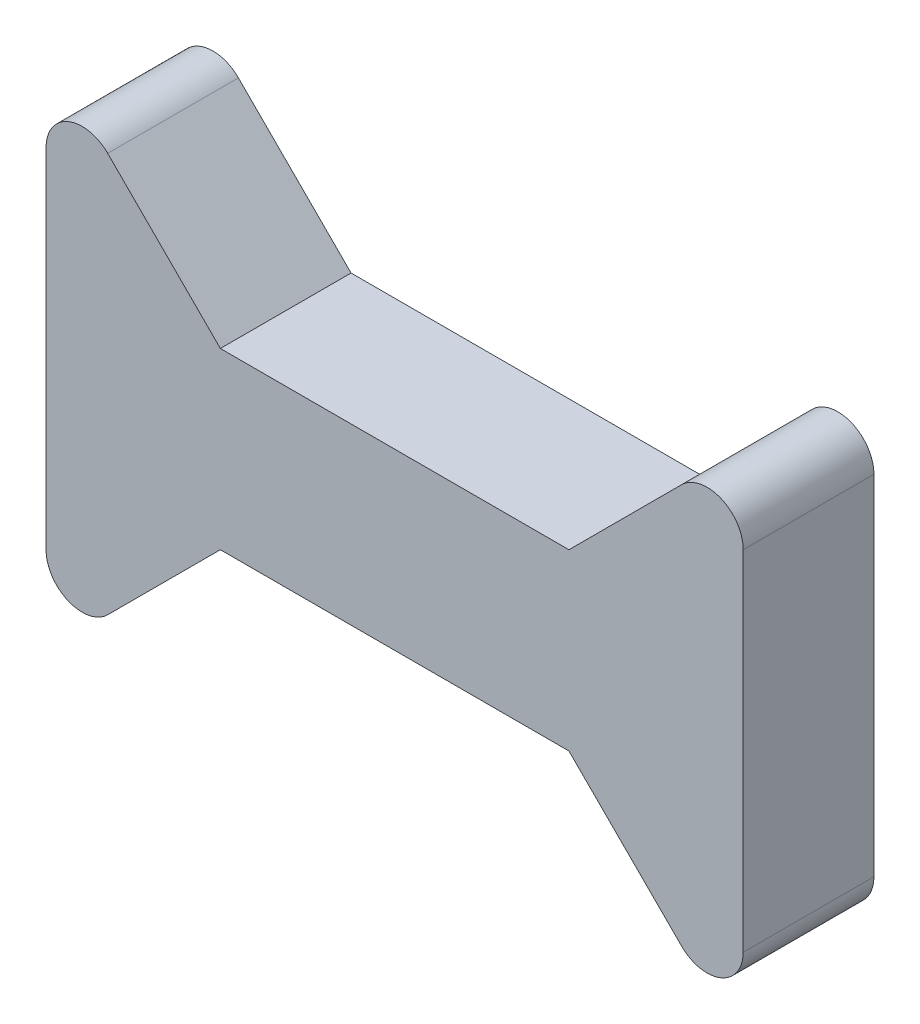
from build123d import *

# Parameters (mm, degrees)
BOSS_EXTRUDE1_DEPTH = 7.5


with BuildPart() as part:
    # Sketch1 → Boss-Extrude1 (new body)
    with BuildSketch(Plane.XY):
        with BuildLine():
            Line((-10, 5), (10, 5))
            Line((10, 5), (16.464466094, 11.464466094))
            ThreePointArc((16.464466094, 11.464466094), (18.721495527, 11.913417162), (20, 10))
            Line((20, 10), (20, -10))
            ThreePointArc((20, -10), (18.721495527, -11.913417162), (16.464466094, -11.464466094))
            Line((16.464466094, -11.464466094), (10, -5))
            Line((10, -5), (-10, -5))
            Line((-10, -5), (-16.464466094, -11.464466094))
            ThreePointArc((-16.464466094, -11.464466094), (-18.721495527, -11.913417162), (-20, -10))
            Line((-20, -10), (-20, 10))
            ThreePointArc((-20, 10), (-18.721495527, 11.913417162), (-16.464466094, 11.464466094))
            Line((-16.464466094, 11.464466094), (-10, 5))
        make_face()
    extrude(amount=BOSS_EXTRUDE1_DEPTH)


solid = part.part
